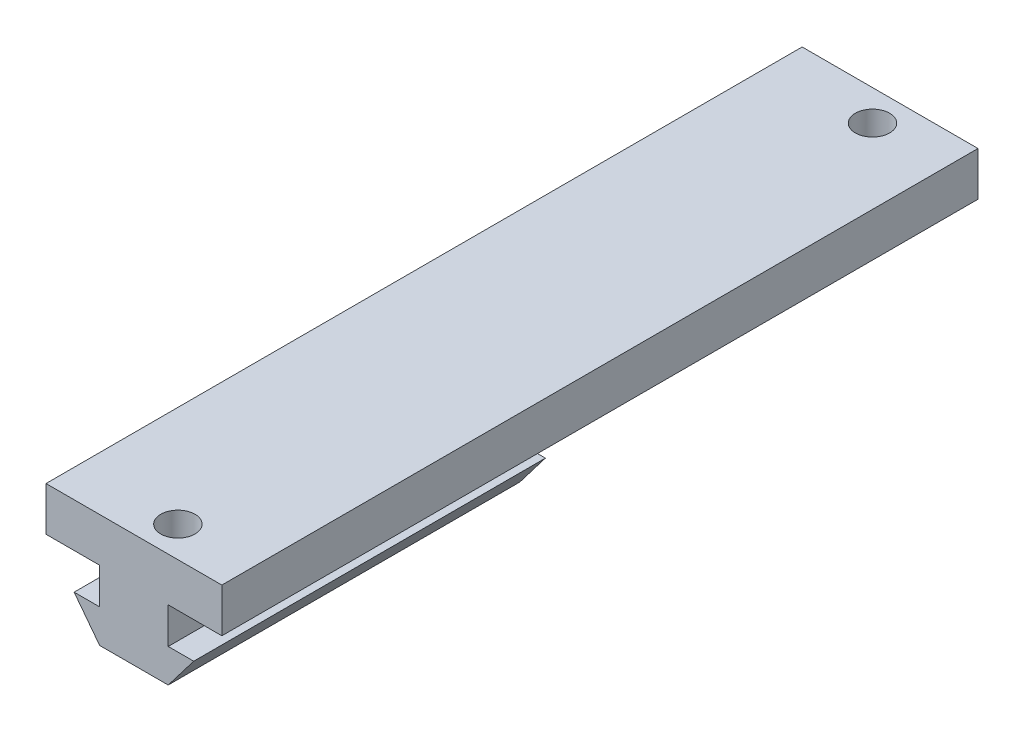
from build123d import *

# Parameters (mm, degrees)
SKETCH1_W           = 20
SKETCH1_H           = 86
BOSS_EXTRUDE1_DEPTH = 5
BOSS_EXTRUDE4_DEPTH = 40
SKETCH2_R           = 1.95
CUT_EXTRUDE1_DEPTH  = 6


with BuildPart() as part:
    # Sketch1 → Boss-Extrude1 (new body)
    with BuildSketch(Plane(origin=(0, 0, 0), x_dir=(1, 0, 0), z_dir=(0, 1, 0))):
        Rectangle(SKETCH1_W, SKETCH1_H)
    extrude(amount=BOSS_EXTRUDE1_DEPTH)

    # Sketch4 → Boss-Extrude4 (add)
    with BuildSketch(Plane.XY.offset(43)):
        Polygon((-3.9, 0), (-3.9, -4.1), (-6.8, -4.1), (-3.9, -7.9), (3.9, -7.9), (6.8, -4.1), (3.9, -4.1), (3.9, 0), align=None)
    extrude(amount=-BOSS_EXTRUDE4_DEPTH)

    # Sketch2 → Cut-Extrude1 (cut)
    with BuildSketch(Plane(origin=(0, 5, 0), x_dir=(1, 0, 0), z_dir=(0, 1, 0))):
        with Locations((1.5, -39.5)):
            Circle(SKETCH2_R)
        with Locations((1.5, 39.5)):
            Circle(SKETCH2_R)
    extrude(amount=-CUT_EXTRUDE1_DEPTH, mode=Mode.SUBTRACT)


solid = part.part
